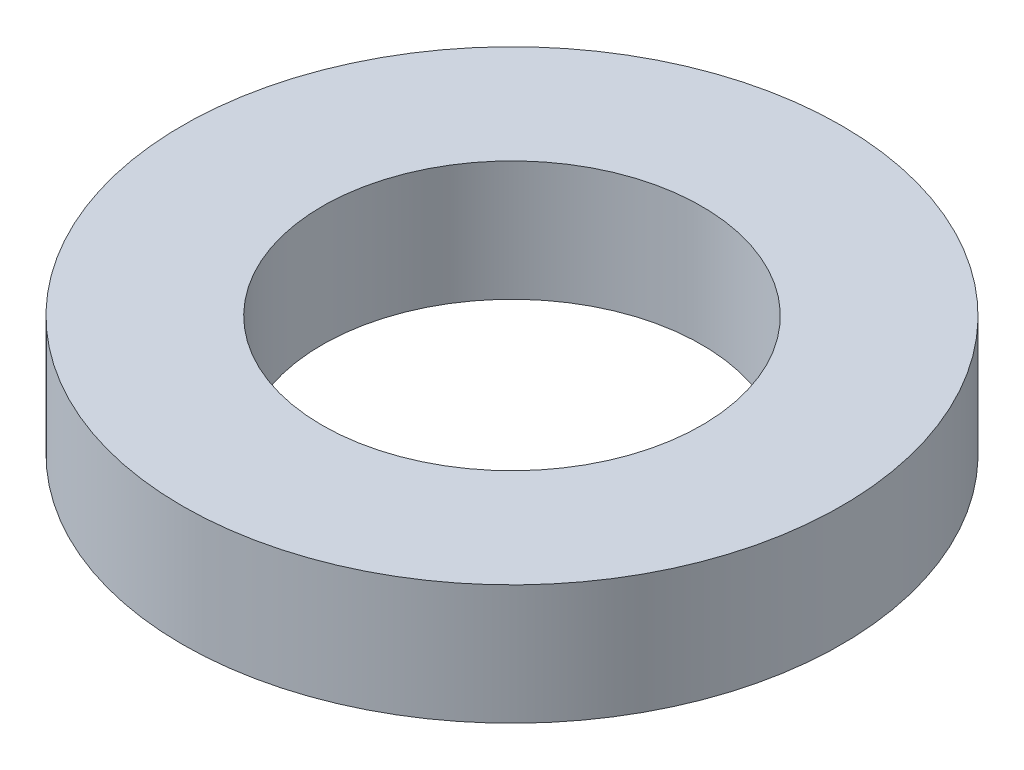
from build123d import *

# Parameters (mm, degrees)
SKETCH1_R           = 82.5
BOSS_EXTRUDE1_DEPTH = 30
SKETCH2_R           = 47.5
CUT_EXTRUDE1_DEPTH  = 121.467838032


with BuildPart() as part:
    # Sketch1 → Boss-Extrude1 (new body)
    with BuildSketch(Plane(origin=(0, 0, 0), x_dir=(1, 0, 0), z_dir=(0, 1, 0))):
        Circle(SKETCH1_R)
    extrude(amount=BOSS_EXTRUDE1_DEPTH)

    # Sketch2 → Cut-Extrude1 (cut, through all)
    with BuildSketch(Plane(origin=(0, 0, 0), x_dir=(1, 0, 0), z_dir=(0, 1, 0))):
        Circle(SKETCH2_R)
    extrude(amount=CUT_EXTRUDE1_DEPTH, mode=Mode.SUBTRACT)


solid = part.part
